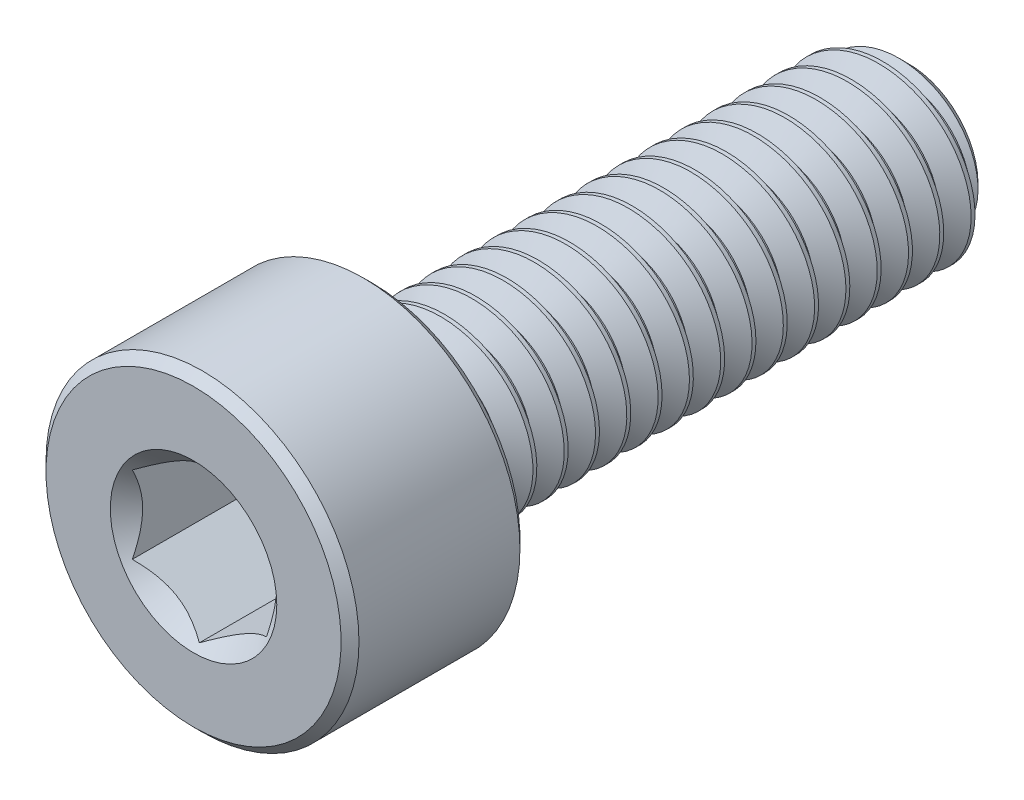
from build123d import *

# Parameters (mm, degrees)
CUT_EXTRUDE1_DEPTH     = 3
SPLIT1_SURFACE_1_BACK  = 19.815
SPLIT1_SURFACE_1_DEPTH = 39.63
SPLIT1_SURFACE_2_BACK  = 19.815
SPLIT1_SURFACE_2_DEPTH = 39.63
CUT_SWEEP1_PITCH       = 0.7
CUT_SWEEP1_TO          = 11.8


with BuildPart() as part:
    # Sketch2 → Revolve1 (revolve)
    with BuildSketch(Plane(origin=(0, 0, 0), x_dir=(0, 0, -1), z_dir=(1, 0, 0))):
        with BuildLine():
            Line((-8, 0), (-8, 3.3))
            Line((-8, 3.3), (-7.8, 3.5))
            Line((-7.8, 3.5), (-4.2, 3.5))
            Line((-4.2, 3.5), (-4, 3.3))
            Line((-4, 3.3), (-4, 2.2))
            ThreePointArc((-4, 2.2), (-3.941421356, 2.058578644), (-3.8, 2))
            Line((-3.8, 2), (7.545336663, 2))
            Line((7.545336663, 2), (8, 1.545336663))
            Line((8, 1.545336663), (8, 0))
            Line((8, 0), (-8, 0))
        make_face()
    revolve(axis=Axis((0, 0, -8), (0, 0, 1)))

    # Sketch3 → Cut-Extrude1 (cut)
    with BuildSketch(Plane.XY.offset(8)):
        Polygon((1.5, -0.866025404), (1.5, 0.866025404), (0, 1.732050808), (-1.5, 0.866025404), (-1.5, -0.866025404), (0, -1.732050808), align=None)
    extrude(amount=-CUT_EXTRUDE1_DEPTH, mode=Mode.SUBTRACT)

    # Cut-Extrude2 cone 1 section (through the dimple's axis) → Cut-Extrude2 (revolve, cut)
    with BuildSketch(Plane(origin=(0, 0, 8), x_dir=(0, -1, 0), z_dir=(1, 0, 0))):
        Polygon((0, 0), (1.861954618, 0), (0, 1.861954618), align=None)
    revolve(axis=Axis((0, 0, 8), (0, 0, -1)), mode=Mode.SUBTRACT)


with BuildPart() as body_2:
    # Split1: the piece behind the surface
    add(part.part)
    # Split1 surface: a surface, the sketch's curves swept straight by 39.63 mm
    with BuildLine(Plane(origin=(0, 0, 0), x_dir=(0, 0, -1), z_dir=(1, 0, 0)).offset(-SPLIT1_SURFACE_1_BACK), mode=Mode.PRIVATE) as split1_surface_1_path:
        Line((-3.8, -3.5), (-3.8, 3.5))
    split1_surface_1 = Shell.extrude(split1_surface_1_path.wire(), (1 * SPLIT1_SURFACE_1_DEPTH, 0 * SPLIT1_SURFACE_1_DEPTH, 0 * SPLIT1_SURFACE_1_DEPTH))
    split(bisect_by=split1_surface_1, keep=Keep.BOTTOM)

    # Cut-Sweep1: arcs per turn and ends read off the stored shape
    # Cut-Sweep1: the profile of Sketch7 screwed along a right-hand helix through 18.142857 turns, 6 arcs to a turn; built about Z, then put on its axis
    cut_sweep1_z = Axis((0, 0, 0), (0, 0, 1))
    cut_sweep1_corners = [(2.037888611, 0, 0.021875), (2.037888611, 0, -0.634375), (1.545336663, 0, -0.35), (1.545336663, 0, -0.2625)]
    with BuildLine(mode=Mode.PRIVATE) as cut_sweep1_profile:
        Line(cut_sweep1_corners[0], cut_sweep1_corners[1])
        Line(cut_sweep1_corners[1], cut_sweep1_corners[2])
        Line(cut_sweep1_corners[2], cut_sweep1_corners[3])
        Line(cut_sweep1_corners[3], cut_sweep1_corners[0])
    cut_sweep1_cap = Face(cut_sweep1_profile.wire())
    cut_sweep1_turn_angles = [0, 30, 60, 90, 120, 150, 180, 210, 240, 270, 300, 330, 360]
    cut_sweep1_turn_weights = [1, 0.8660254037844387, 1, 0.8660254037844387, 1, 0.8660254037844387, 1, 0.8660254037844387, 1, 0.8660254037844387, 1, 0.8660254037844387, 1]
    cut_sweep1_turn_rails = [Edge.make_bspline([Vector(p[0], p[1], 0).rotate(cut_sweep1_z, cut_sweep1_turn_angles[k]) / cut_sweep1_turn_weights[k] + Vector(0, 0, p[2] + CUT_SWEEP1_PITCH * cut_sweep1_turn_angles[k] / 360) for k in range(13)], [0, 0, 0, 1, 1, 2, 2, 3, 3, 4, 4, 5, 5, 6, 6, 6], 2, cut_sweep1_turn_weights) for p in cut_sweep1_corners]
    cut_sweep1_turn_sides = [Face.make_surface_from_curves(cut_sweep1_turn_rails[p[0]], cut_sweep1_turn_rails[p[1]]) for p in [(0, 1), (1, 2), (2, 3), (3, 0)]]
    cut_sweep1_last_angles = [6480, 6505.714285714, 6531.428571429]
    cut_sweep1_last_weights = [1, 0.9009688679026391, 1]
    cut_sweep1_last_rails = [Edge.make_bspline([Vector(p[0], p[1], 0).rotate(cut_sweep1_z, cut_sweep1_last_angles[k]) / cut_sweep1_last_weights[k] + Vector(0, 0, p[2] + CUT_SWEEP1_PITCH * cut_sweep1_last_angles[k] / 360) for k in range(3)], [0, 0, 0, 1, 1, 1], 2, cut_sweep1_last_weights) for p in cut_sweep1_corners]
    cut_sweep1_last_sides = [Face.make_surface_from_curves(cut_sweep1_last_rails[p[0]], cut_sweep1_last_rails[p[1]]) for p in [(0, 1), (1, 2), (2, 3), (3, 0)]]
    cut_sweep1 = Plane(origin=(0, 0, -8), x_dir=(0, 1, 0), z_dir=(0, 0, 1)) * split(Solid(Shell([*[p.moved(Location((0, 0, CUT_SWEEP1_PITCH * i))) for i in range(18) for p in cut_sweep1_turn_sides], *cut_sweep1_last_sides, cut_sweep1_cap, cut_sweep1_cap.rotate(cut_sweep1_z, 6531.428571429).moved(Location((0, 0, CUT_SWEEP1_PITCH * 6531.428571429 / 360)))])), bisect_by=Plane.XY.offset(CUT_SWEEP1_TO), keep=Keep.BOTTOM, mode=Mode.PRIVATE)
    add(cut_sweep1, mode=Mode.SUBTRACT)


with BuildPart() as part_1:
    add(part.part)

    # Split1: split by a surface, the side it looks to stays
    # Split1 surface: a surface, the sketch's curves swept straight by 39.63 mm
    with BuildLine(Plane(origin=(0, 0, 0), x_dir=(0, 0, -1), z_dir=(1, 0, 0)).offset(-SPLIT1_SURFACE_2_BACK), mode=Mode.PRIVATE) as split1_surface_2_path:
        Line((-3.8, -3.5), (-3.8, 3.5))
    split1_surface_2 = Shell.extrude(split1_surface_2_path.wire(), (1 * SPLIT1_SURFACE_2_DEPTH, 0 * SPLIT1_SURFACE_2_DEPTH, 0 * SPLIT1_SURFACE_2_DEPTH))
    split(bisect_by=split1_surface_2, keep=Keep.TOP)

    add(body_2.part)  # Revolve2 merges body 2
    # Sketch8 → Revolve2 (revolve)
    with BuildSketch(Plane(origin=(0, 0, 0), x_dir=(0, 0, -1), z_dir=(1, 0, 0)), mode=Mode.PRIVATE) as revolve2_sk:
        Polygon((-4, 0), (-4, 2), (-3.8, 2), (-2.645299462, 0), align=None)
    revolve(revolve2_sk.sketch.rotate(Axis((0, 0, 2.645299462), (0, 0, 1)), 270), axis=Axis((0, 0, 2.645299462), (0, 0, 1)))


solid = part_1.part
